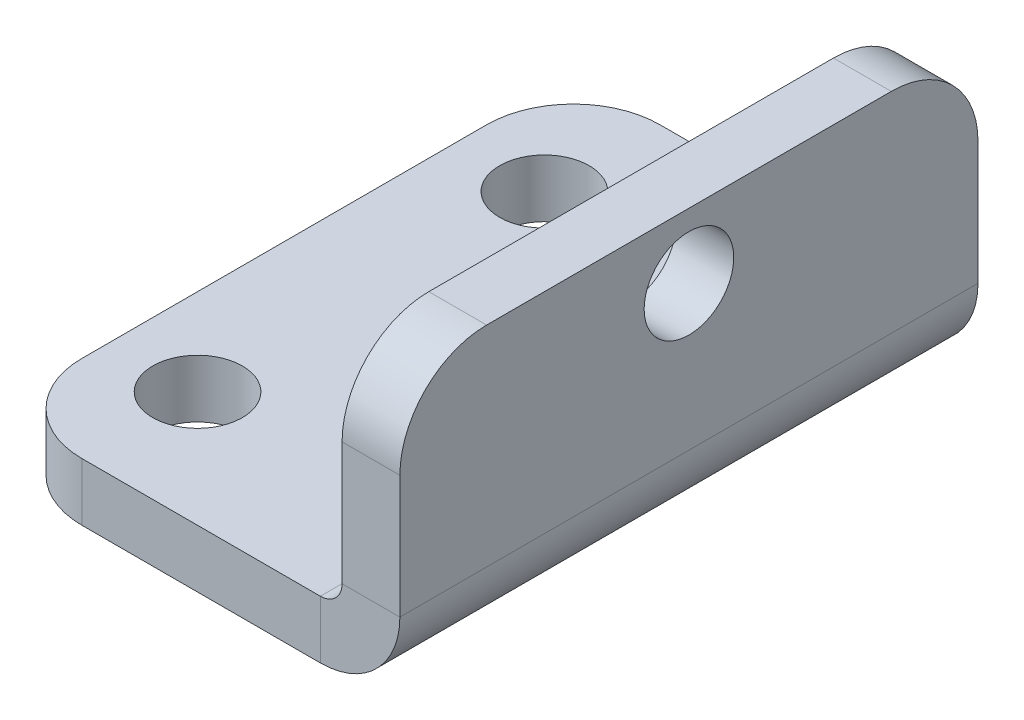
from build123d import *

# Parameters (mm, degrees)
BASE_FLANGE1_DEPTH = 10
FILLET1_R          = 3
SKETCH6_R          = 1.55
CUT_EXTRUDE1_DEPTH = 18.549928775
SKETCH7_R          = 1.55
CUT_EXTRUDE2_DEPTH = 18.549928775


# Sheet-metal steps are written as plain solids
with BuildPart() as part:
    # Sketch1 → Base-Flange1 (new, symmetric)
    with BuildSketch(Plane.XY):
        with BuildLine():
            Line((-12, 0), (-0.75, 0))
            ThreePointArc((-0.75, 0), (-0.219669914, 0.219669914), (0, 0.75))
            Line((0, 0.75), (0, 8))
            Line((0, 8), (2, 8))
            Line((2, 8), (2, 0.75))
            ThreePointArc((2, 0.75), (1.194543648, -1.194543648), (-0.75, -2))
            Line((-0.75, -2), (-12, -2))
            Line((-12, -2), (-12, 0))
        make_face()
    extrude(amount=BASE_FLANGE1_DEPTH, both=True)

    # Fillet1
    fillet1_edges = [part.edges().sort_by_distance(p)[0] for p in [
        (-12, -1, 10),
        (1, 8, 10),
        (-12, -1, -10),
        (1, 8, -10),
    ]]
    fillet(fillet1_edges, radius=FILLET1_R)

    # Sketch6 → Cut-Extrude1 (cut, through all)
    with BuildSketch(Plane(origin=(0, 0, 0), x_dir=(1, 0, 0), z_dir=(0, 1, 0))):
        with Locations(Location((-9, 6, 0), (0, 0, 270))):
            Circle(SKETCH6_R)
        with Locations(Location((-9, -6, 0), (0, 0, 90))):
            Circle(SKETCH6_R)
    extrude(amount=-CUT_EXTRUDE1_DEPTH, mode=Mode.SUBTRACT)

    # Sketch7 → Cut-Extrude2 (cut, through all)
    with BuildSketch(Plane.ZY):
        with Locations((0, 5.75)):
            Circle(SKETCH7_R)
    extrude(amount=-CUT_EXTRUDE2_DEPTH, mode=Mode.SUBTRACT)


solid = part.part
